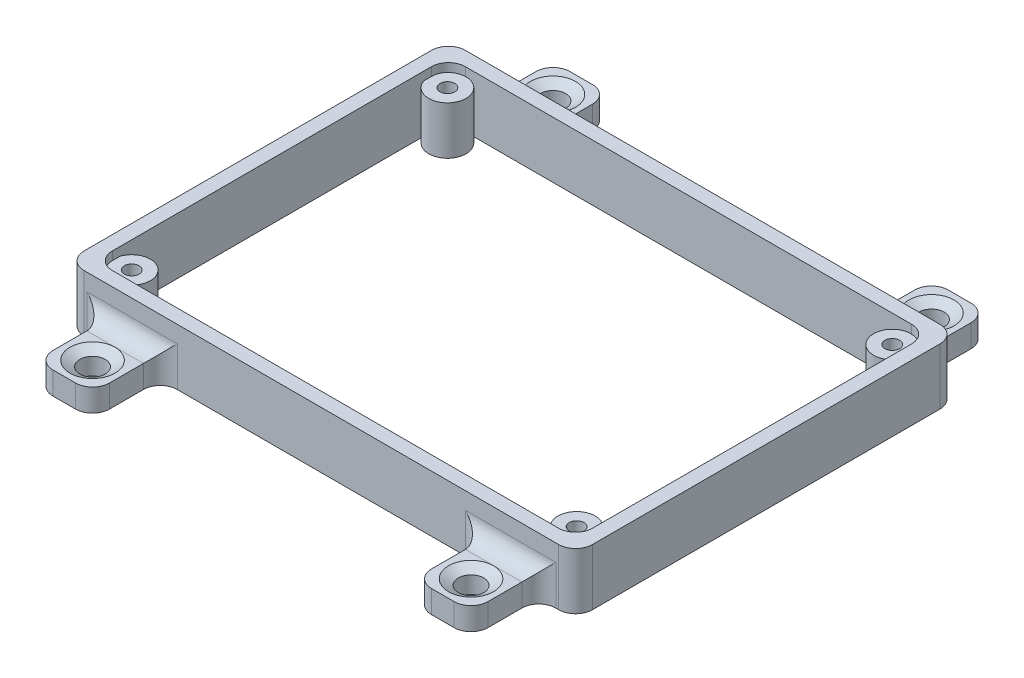
from build123d import *
from OCP.BRepFilletAPI import BRepFilletAPI_MakeChamfer

# Parameters (mm, degrees)
SKETCH5_W             = 90
SKETCH5_H             = 67.5
SKETCH5_W_2           = 85
SKETCH5_H_2           = 62.5
BOSS_EXTRUDE3_DEPTH   = 10
FILLET1_R             = 3
SKETCH7_R             = 3.3
SKETCH7_R_2           = 1.3
BOSS_EXTRUDE5_DEPTH   = 8.5
SKETCH11_W            = 10
SKETCH11_H            = 4
BOSS_EXTRUDE6_DEPTH   = 12
FILLET3_R             = 3
SKETCH13_R            = 2.25
CUT_EXTRUDE1_DEPTH    = 113.659886384
CHAMFER2_SIZE         = 1
CHAMFER2_SIZE2        = 1.732050808
CIRPATTERN1_OUTLINE_R = 2.25
CIRPATTERN1_DEPTH     = 2.9999999
CIRPATTERN1_START     = 2.9999999
CIRPATTERN1_2_DEPTH   = 1.0000001
FILLET5_R             = 3


with BuildPart() as part:
    # Sketch5 → Boss-Extrude3 (new body)
    with BuildSketch(Plane(origin=(0, 0, 0), x_dir=(1, 0, 0), z_dir=(0, 1, 0))):
        with Locations((45, 33.75)):
            Rectangle(SKETCH5_W, SKETCH5_H)
        with Locations((45, 33.75)):
            Rectangle(SKETCH5_W_2, SKETCH5_H_2, mode=Mode.SUBTRACT)
    extrude(amount=BOSS_EXTRUDE3_DEPTH)

    # Fillet1
    fillet1_edges = [part.edges().sort_by_distance(p)[0] for p in [
        (87.5, 5, -2.5),
        (87.5, 5, -65),
        (2.5, 5, -65),
        (2.5, 5, -2.5),
        (90, 5, -67.5),
        (90, 5, 0),
        (0, 5, 0),
        (0, 5, -67.5),
    ]]
    fillet(fillet1_edges, radius=FILLET1_R)

    # Sketch7 → Boss-Extrude5 (add)
    # profile 1 of 4: a face of its own
    with BuildSketch(Plane(origin=(0, 0, 0), x_dir=(1, 0, 0), z_dir=(0, 1, 0))):
        with Locations((5.63, 5.81)):
            Circle(SKETCH7_R)
        with Locations(Location((5.63, 5.81, 0), (0, 0, 270))):
            Circle(SKETCH7_R_2, mode=Mode.SUBTRACT)
    # profile 2 of 4: a face of its own
    with BuildSketch(Plane(origin=(0, 0, 0), x_dir=(1, 0, 0), z_dir=(0, 1, 0))):
        with Locations((5.63, 61.69)):
            Circle(SKETCH7_R)
        with Locations(Location((5.63, 61.69, 0), (0, 0, 270))):
            Circle(SKETCH7_R_2, mode=Mode.SUBTRACT)
    # profile 3 of 4: a face of its own
    with BuildSketch(Plane(origin=(0, 0, 0), x_dir=(1, 0, 0), z_dir=(0, 1, 0))):
        with Locations((84.37, 5.81)):
            Circle(SKETCH7_R)
        with Locations(Location((84.37, 5.81, 0), (0, 0, 270))):
            Circle(SKETCH7_R_2, mode=Mode.SUBTRACT)
    # profile 4 of 4: a face of its own
    with BuildSketch(Plane(origin=(0, 0, 0), x_dir=(1, 0, 0), z_dir=(0, 1, 0))):
        with Locations((84.37, 61.69)):
            Circle(SKETCH7_R)
        with Locations(Location((84.37, 61.69, 0), (0, 0, 270))):
            Circle(SKETCH7_R_2, mode=Mode.SUBTRACT)
    extrude(amount=BOSS_EXTRUDE5_DEPTH)

    # Sketch11 → Boss-Extrude6 (add)
    with BuildSketch(Plane.XY):
        with Locations((11.5, 2)):
            Rectangle(SKETCH11_W, SKETCH11_H)
        with Locations((78.5, 2)):
            Rectangle(SKETCH11_W, SKETCH11_H)
    extrude(amount=BOSS_EXTRUDE6_DEPTH)

    # Fillet3
    fillet3_edges = [part.edges().sort_by_distance(p)[0] for p in [
        (6.5, 2, 0),
        (16.5, 2, 0),
        (11.5, 4, 0),
        (6.5, 2, 12),
        (16.5, 2, 12),
        (73.5, 2, 0),
        (83.5, 2, 0),
        (78.5, 4, 0),
        (73.5, 2, 12),
        (83.5, 2, 12),
    ]]
    fillet(fillet3_edges, radius=FILLET3_R)

    # Sketch13 → Cut-Extrude1 (cut, through all)
    with BuildSketch(Plane(origin=(0, 4, 0), x_dir=(1, 0, 0), z_dir=(0, 1, 0))):
        with Locations(Location((11.5, -7, 0), (0, 0, 270))):
            Circle(SKETCH13_R)
        with Locations(Location((78.5, -7, 0), (0, 0, 270))):
            Circle(SKETCH13_R)
    extrude(amount=-CUT_EXTRUDE1_DEPTH, mode=Mode.SUBTRACT)

    # Chamfer2: one chamfer whose edges measure the first distance from different faces: ONE call of the kernel's chamfer builder (chamfer() names one face for all edges)
    chamfer2_edges_1 = [part.edges().sort_by_distance(p)[0] for p in [
        (11.5, 4, 4.75),
    ]]
    chamfer2_side_1 = [part.faces().sort_by_distance(p)[0] for p in [
        (11.5, 2, 4.75),
    ]]
    chamfer2_edges_2 = [part.edges().sort_by_distance(p)[0] for p in [
        (78.5, 4, 4.75),
    ]]
    chamfer2_side_2 = [part.faces().sort_by_distance(p)[0] for p in [
        (78.5, 2, 4.75),
    ]]
    chamfer2 = BRepFilletAPI_MakeChamfer(part.part.solid().wrapped)
    for e in chamfer2_edges_1:
        chamfer2.Add(CHAMFER2_SIZE, CHAMFER2_SIZE2, e.wrapped, chamfer2_side_1[0].wrapped)  # the first distance lies on this face
    for e in chamfer2_edges_2:
        chamfer2.Add(CHAMFER2_SIZE, CHAMFER2_SIZE2, e.wrapped, chamfer2_side_2[0].wrapped)  # the first distance lies on this face
    add(Compound.cast(chamfer2.Shape()), mode=Mode.REPLACE)

    # CirPattern1: read off the stored shape, not the designer's step
    # CirPattern1 outline → CirPattern1 (add)
    # profile 1 of 2: a face of its own
    with BuildSketch(Plane(origin=(0, 0, 0), x_dir=(1, 0, 0), z_dir=(0, 1, 0))):
        with BuildLine():
            Line((73.5, 76.5), (73.5, 67.5))
            Line((73.5, 67.5), (83.5, 67.5))
            Line((83.5, 67.5), (83.5, 76.5))
            ThreePointArc((83.5, 76.5), (82.621320344, 78.621320344), (80.5, 79.5))
            Line((80.5, 79.5), (76.5, 79.5))
            ThreePointArc((76.5, 79.5), (74.378679656, 78.621320344), (73.5, 76.5))
        make_face()
        with Locations((78.5, 74.5)):
            Circle(CIRPATTERN1_OUTLINE_R, mode=Mode.SUBTRACT)
    # profile 2 of 2: a face of its own
    with BuildSketch(Plane(origin=(0, 0, 0), x_dir=(1, 0, 0), z_dir=(0, 1, 0))):
        with BuildLine():
            Line((6.5, 76.5), (6.5, 67.5))
            Line((6.5, 67.5), (16.5, 67.5))
            Line((16.5, 67.5), (16.5, 76.5))
            ThreePointArc((16.5, 76.5), (15.621320344, 78.621320344), (13.5, 79.5))
            Line((13.5, 79.5), (9.5, 79.5))
            ThreePointArc((9.5, 79.5), (7.378679656, 78.621320344), (6.5, 76.5))
        make_face()
        with Locations((11.5, 74.5)):
            Circle(CIRPATTERN1_OUTLINE_R, mode=Mode.SUBTRACT)
    extrude(amount=CIRPATTERN1_DEPTH)

    # CirPattern1 2 outline → CirPattern1 2 (add)
    with BuildSketch(Plane(origin=(0, 0, 0), x_dir=(1, 0, 0), z_dir=(0, 1, 0)).offset(CIRPATTERN1_START)):
        with BuildLine():
            Line((73.5, 76.5), (73.5, 67.5))
            Line((73.5, 67.5), (83.5, 67.5))
            Line((83.5, 67.5), (83.5, 76.5))
            ThreePointArc((83.5, 76.5), (82.621320344, 78.621320344), (80.5, 79.5))
            Line((80.5, 79.5), (76.5, 79.5))
            ThreePointArc((76.5, 79.5), (74.378679656, 78.621320344), (73.5, 76.5))
        make_face()
        with BuildLine():
            Line((6.5, 76.5), (6.5, 67.5))
            Line((6.5, 67.5), (16.5, 67.5))
            Line((16.5, 67.5), (16.5, 76.5))
            ThreePointArc((16.5, 76.5), (15.621320344, 78.621320344), (13.5, 79.5))
            Line((13.5, 79.5), (9.5, 79.5))
            ThreePointArc((9.5, 79.5), (7.378679656, 78.621320344), (6.5, 76.5))
        make_face()
    extrude(amount=CIRPATTERN1_2_DEPTH)

    # CirPattern1 3: loft between two sections, ruled curve by curve
    cirpattern1_3_from = [
        Edge.make_three_point_arc((11.5, 3, -76.75), (9.25, 3, -74.5), (11.5, 3, -72.25)),
        Edge.make_three_point_arc((11.5, 3, -72.25), (13.75, 3, -74.5), (11.5, 3, -76.75)),
    ]
    cirpattern1_3_to = [
        Edge.make_three_point_arc((11.5, 4, -78.482050808), (7.517949192, 4, -74.5), (11.5, 4, -70.517949192)),
        Edge.make_three_point_arc((11.5, 4, -70.517949192), (15.482050808, 4, -74.5), (11.5, 4, -78.482050808)),
    ]
    cirpattern1_3 = Solid(Shell([*[Face.make_surface_from_curves(cirpattern1_3_from[k], cirpattern1_3_to[k]) for k in range(2)], Face(Wire(cirpattern1_3_from)), Face(Wire(cirpattern1_3_to))]))
    add(cirpattern1_3, mode=Mode.SUBTRACT)

    # CirPattern1 4: loft between two sections, ruled curve by curve
    cirpattern1_4_from = [
        Edge.make_three_point_arc((78.5, 3, -76.75), (76.25, 3, -74.5), (78.5, 3, -72.25)),
        Edge.make_three_point_arc((78.5, 3, -72.25), (80.75, 3, -74.5), (78.5, 3, -76.75)),
    ]
    cirpattern1_4_to = [
        Edge.make_three_point_arc((78.5, 4, -78.482050808), (74.517949192, 4, -74.5), (78.5, 4, -70.517949192)),
        Edge.make_three_point_arc((78.5, 4, -70.517949192), (82.482050808, 4, -74.5), (78.5, 4, -78.482050808)),
    ]
    cirpattern1_4 = Solid(Shell([*[Face.make_surface_from_curves(cirpattern1_4_from[k], cirpattern1_4_to[k]) for k in range(2)], Face(Wire(cirpattern1_4_from)), Face(Wire(cirpattern1_4_to))]))
    add(cirpattern1_4, mode=Mode.SUBTRACT)

    # Fillet5
    fillet5_edges = [part.edges().sort_by_distance(p)[0] for p in [
        (83.5, 2, -67.5),
        (73.5, 2, -67.5),
        (78.5, 4, -67.5),
        (16.5, 2, -67.5),
        (6.5, 2, -67.5),
        (11.5, 4, -67.5),
    ]]
    fillet(fillet5_edges, radius=FILLET5_R)


solid = part.part
